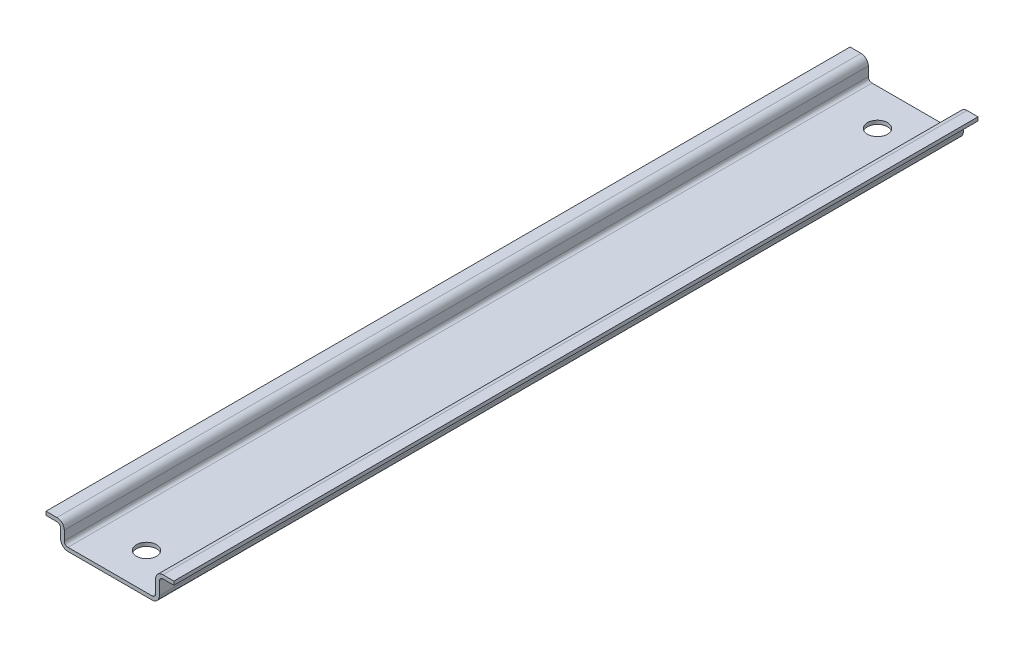
from build123d import *

# Parameters (mm, degrees)
BOSS_EXTRUDE1_DEPTH = 220
SKETCH2_R           = 2.75
CUT_EXTRUDE1_DEPTH  = 1


with BuildPart() as part:
    # Sketch1 → Boss-Extrude1 (new body)
    with BuildSketch(Plane.XY):
        with BuildLine():
            Line((2, 0), (25, 0))
            ThreePointArc((25, 0), (26.414213562, 0.585786438), (27, 2))
            Line((27, 2), (27, 5.5))
            ThreePointArc((27, 5.5), (27.292893219, 6.207106781), (28, 6.5))
            Line((28, 6.5), (31, 6.5))
            Line((31, 6.5), (31, 7.5))
            Line((31, 7.5), (28, 7.5))
            ThreePointArc((28, 7.5), (26.585786438, 6.914213562), (26, 5.5))
            Line((26, 5.5), (26, 2))
            ThreePointArc((26, 2), (25.707106781, 1.292893219), (25, 1))
            Line((25, 1), (2, 1))
            ThreePointArc((2, 1), (1.292893219, 1.292893219), (1, 2))
            Line((1, 2), (1, 4.544540718))
            ThreePointArc((1, 4.544540718), (0.414213562, 5.95875428), (-1, 6.544540718))
            Line((-1, 6.544540718), (-4, 6.544540718))
            Line((-4, 6.544540718), (-4, 5.544540718))
            Line((-4, 5.544540718), (-1, 5.544540718))
            ThreePointArc((-1, 5.544540718), (-0.292893219, 5.251647499), (0, 4.544540718))
            Line((0, 4.544540718), (0, 2))
            ThreePointArc((0, 2), (0.585786438, 0.585786438), (2, 0))
        make_face()
    extrude(amount=BOSS_EXTRUDE1_DEPTH)

    # Sketch2 → Cut-Extrude1 (cut)
    with BuildSketch(Plane(origin=(0, 1, 0), x_dir=(1, 0, 0), z_dir=(0, 1, 0))):
        with Locations((13.5, -10)):
            Circle(SKETCH2_R)
        with Locations((13.5, -210)):
            Circle(SKETCH2_R)
    extrude(amount=-CUT_EXTRUDE1_DEPTH, mode=Mode.SUBTRACT)


solid = part.part
